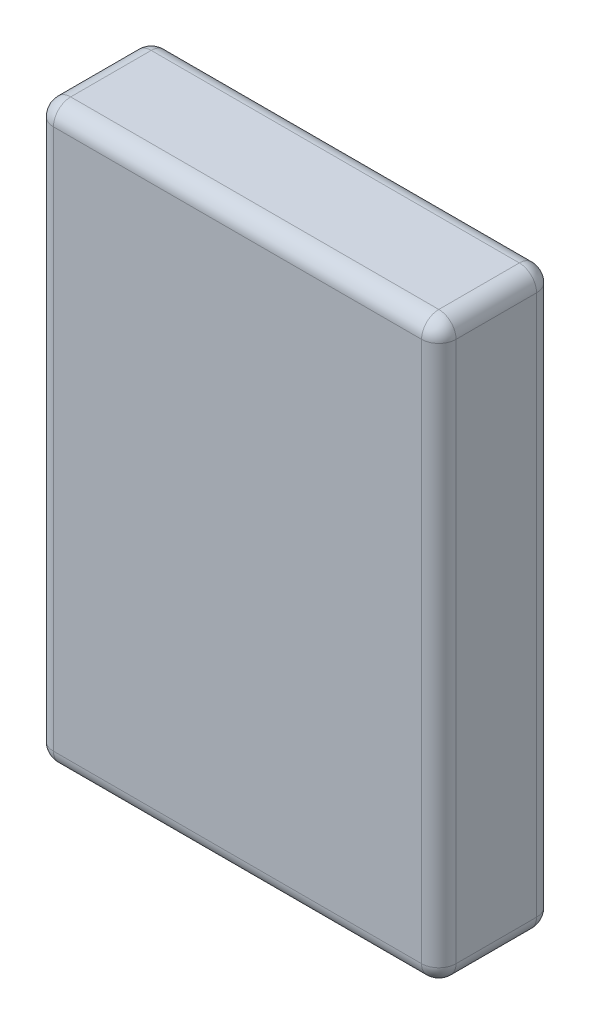
from build123d import *

# Parameters (mm, degrees)
SKETCH1_W           = 70
SKETCH1_H           = 100
BOSS_EXTRUDE1_DEPTH = 20
FILLET1_R           = 3


with BuildPart() as part:
    # Sketch1 → Boss-Extrude1 (new body)
    with BuildSketch(Plane.XY):
        with Locations((35, 50)):
            Rectangle(SKETCH1_W, SKETCH1_H)
    extrude(amount=BOSS_EXTRUDE1_DEPTH)

    # Fillet1
    fillet1_edges = [part.edges().sort_by_distance(p)[0] for p in [
        (35, 0, 0),
        (70, 50, 0),
        (35, 100, 0),
        (0, 50, 0),
        (35, 100, 20),
        (70, 50, 20),
        (35, 0, 20),
        (0, 50, 20),
        (0, 100, 10),
        (70, 100, 10),
        (0, 0, 10),
        (70, 0, 10),
    ]]
    fillet(fillet1_edges, radius=FILLET1_R)


solid = part.part
